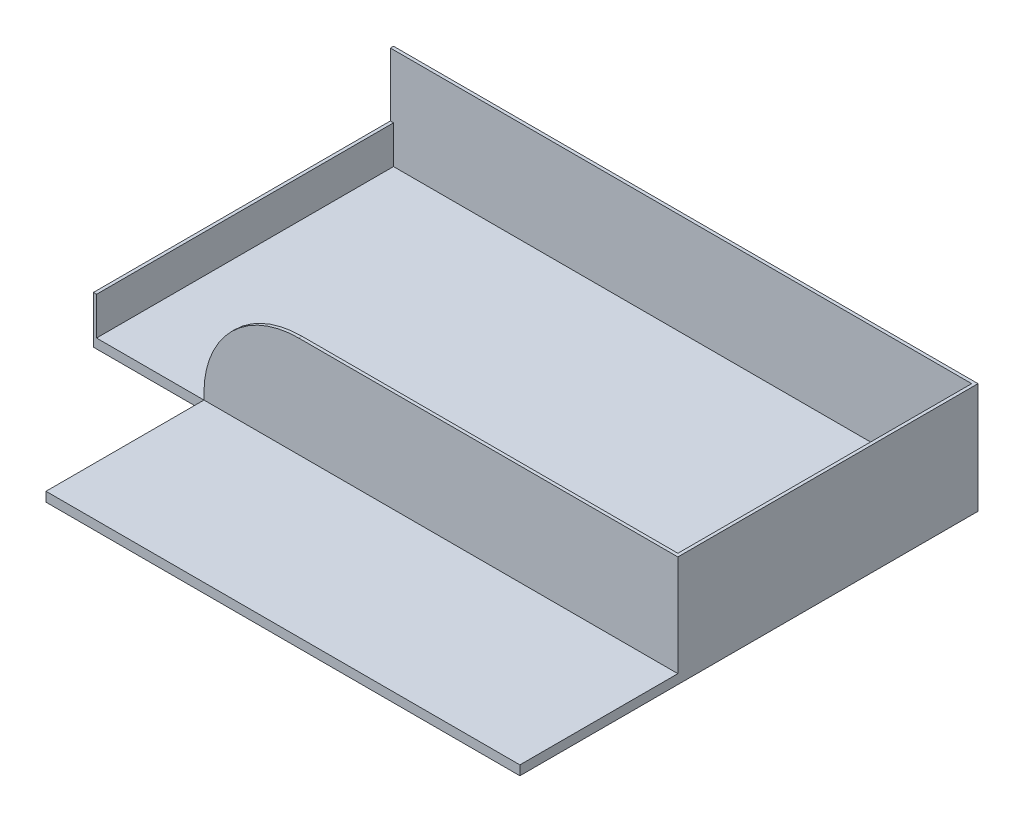
from build123d import *

# Parameters (mm, degrees)
SKETCH1_W           = 1850
SKETCH1_H           = 950
BOSS_EXTRUDE1_DEPTH = 30
BOSS_EXTRUDE2_DEPTH = 350
BOSS_EXTRUDE4_DEPTH = 30
BOSS_EXTRUDE5_DEPTH = 10
SKETCH4_W           = 950
SKETCH4_H           = 150
BOSS_EXTRUDE6_DEPTH = 10


with BuildPart() as part:
    # Sketch1 → Boss-Extrude1 (new body)
    with BuildSketch(Plane(origin=(0, 0, 0), x_dir=(1, 0, 0), z_dir=(0, 1, 0))):
        with Locations((925, -475)):
            Rectangle(SKETCH1_W, SKETCH1_H)
    extrude(amount=BOSS_EXTRUDE1_DEPTH)

    # Sketch1<3> → Boss-Extrude2 (add)
    with BuildSketch(Plane(origin=(0, 0, 0), x_dir=(1, 0, 0), z_dir=(0, 1, 0))):
        Polygon((0, 0), (0, -10), (1840, -10), (1840, -950), (1850, -950), (1850, 0), align=None)
    extrude(amount=BOSS_EXTRUDE2_DEPTH)

    # Sketch1<4> → Boss-Extrude4 (add)
    with BuildSketch(Plane(origin=(0, 0, 0), x_dir=(1, 0, 0), z_dir=(0, 1, 0))):
        Polygon((1850, -950), (1840, -950), (350, -950), (350, -1450), (1850, -1450), align=None)
    extrude(amount=BOSS_EXTRUDE4_DEPTH)

    # Sketch3 → Boss-Extrude5 (add)
    with BuildSketch(Plane.XY.offset(950)):
        with BuildLine():
            Line((350, 30), (1850, 30))
            Line((1850, 30), (1850, 350))
            Line((1850, 350), (650, 350))
            ThreePointArc((650, 350), (437.867965644, 262.132034356), (350, 50))
            Line((350, 50), (350, 30))
        make_face()
    extrude(amount=-BOSS_EXTRUDE5_DEPTH)

    # Sketch4 → Boss-Extrude6 (add)
    with BuildSketch(Plane.ZY):
        with Locations((475, 75)):
            Rectangle(SKETCH4_W, SKETCH4_H)
    extrude(amount=-BOSS_EXTRUDE6_DEPTH)


solid = part.part
